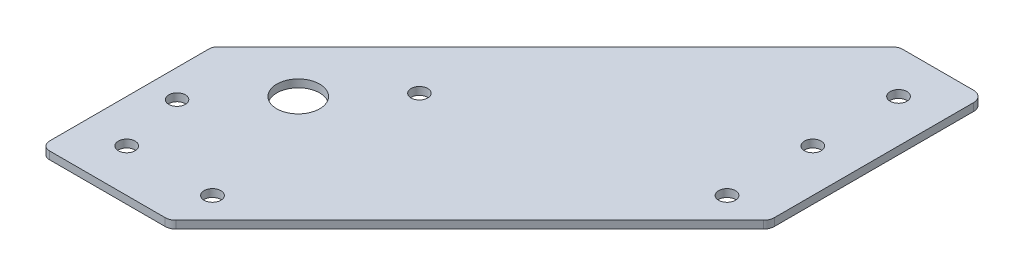
from build123d import *

# Parameters (mm, degrees)
SKETCH1_R                    = 2.4892
SKETCH1_R_2                  = 6.35
BOSS_EXTRUDE2_DEPTH          = 1.143
CUT_EXTRUDE1_DEPTH           = 216.53826991
FILLET3_R                    = 3.175
F_10_0_1935_DIAMETER_HOLE1_D = 4.9149
SKETCH8_W                    = 25.4
SKETCH8_H                    = 50.8
CUT_EXTRUDE2_DEPTH           = 2.54
FILLET4_R                    = 2.54


with BuildPart() as part:
    # Sketch1 → Boss-Extrude2 (new, symmetric)
    with BuildSketch(Plane(origin=(0, 0, 0), x_dir=(1, 0, 0), z_dir=(0, 1, 0))):
        Polygon((0, 0), (0, 152.4), (-25.4, 152.4), (-152.4, 25.4), (-152.4, 0), align=None)
        with Locations((-12.7, 12.7)):
            Circle(SKETCH1_R, mode=Mode.SUBTRACT)
        with Locations((-38.1, 12.7)):
            Circle(SKETCH1_R, mode=Mode.SUBTRACT)
        with Locations((-63.5, 12.7)):
            Circle(SKETCH1_R, mode=Mode.SUBTRACT)
        with Locations((-88.9, 12.7)):
            Circle(SKETCH1_R, mode=Mode.SUBTRACT)
        with Locations((-114.3, 12.7)):
            Circle(SKETCH1_R, mode=Mode.SUBTRACT)
        with Locations((-12.7, 38.1)):
            Circle(SKETCH1_R, mode=Mode.SUBTRACT)
        with Locations((-12.7, 63.5)):
            Circle(SKETCH1_R, mode=Mode.SUBTRACT)
        with Locations((-12.7, 88.9)):
            Circle(SKETCH1_R, mode=Mode.SUBTRACT)
        with Locations((-12.7, 114.3)):
            Circle(SKETCH1_R, mode=Mode.SUBTRACT)
        with Locations((-139.7, 12.7)):
            Circle(SKETCH1_R, mode=Mode.SUBTRACT)
        with Locations((-12.7, 139.7)):
            Circle(SKETCH1_R, mode=Mode.SUBTRACT)
        with Locations((-101.6, 50.8)):
            Circle(SKETCH1_R_2, mode=Mode.SUBTRACT)
    extrude(amount=BOSS_EXTRUDE2_DEPTH, both=True)

    # Sketch2 → Cut-Extrude1 (cut, through all)
    with BuildSketch(Plane(origin=(0, 1.143, 0), x_dir=(1, 0, 0), z_dir=(0, 1, 0))):
        Polygon((0, 0), (0, 88.9), (-88.9, 0), align=None)
    extrude(amount=-CUT_EXTRUDE1_DEPTH, mode=Mode.SUBTRACT)

    # Fillet3
    fillet3_edges = [part.edges().sort_by_distance(p)[0] for p in [
        (-152.4, 0, 0),
        (-25.4, 0, -152.4),
        (0, 0, -152.4),
        (0, 0, -88.9),
        (-88.9, 0, 0),
        (-152.4, 0, -25.4),
    ]]
    fillet(fillet3_edges, radius=FILLET3_R)

    # #10 (0.1935) Diameter Hole1 (through all)
    with Locations(Plane(origin=(0, 1.143, 0), x_dir=(1, 0, 0), z_dir=(0, 1, 0))):
        with Locations((-118.726441846, 32.042468454), (-84.473558154, 69.557531546), (-101.6, 50.8)):
            Hole(F_10_0_1935_DIAMETER_HOLE1_D / 2)

    # Sketch8 → Cut-Extrude2 (cut)
    with BuildSketch(Plane(origin=(0, 1.143, 0), x_dir=(1, 0, 0), z_dir=(0, 1, 0))):
        with Locations((-139.7, 25.4)):
            Rectangle(SKETCH8_W, SKETCH8_H)
    extrude(amount=-CUT_EXTRUDE2_DEPTH, mode=Mode.SUBTRACT)

    # Fillet4
    fillet4_edges = [part.edges().sort_by_distance(p)[0] for p in [
        (-127, 0, 0),
        (-127, 0, -50.8),
    ]]
    fillet(fillet4_edges, radius=FILLET4_R)


solid = part.part
